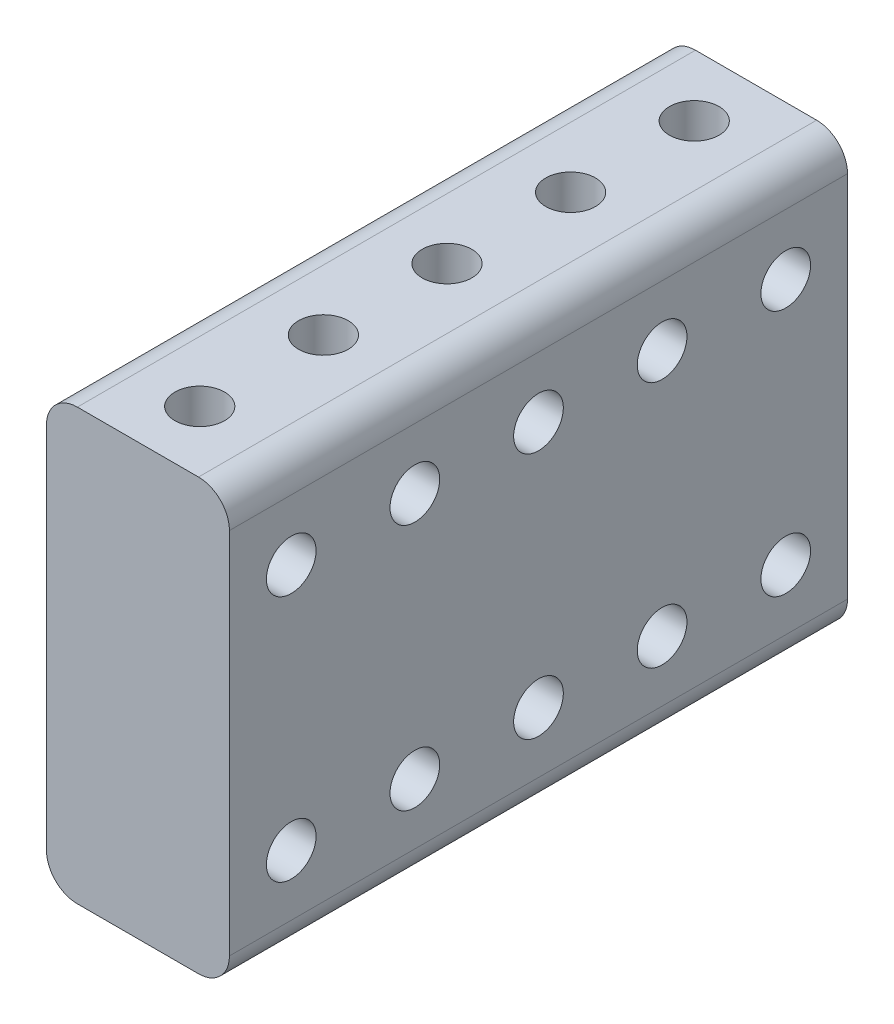
from build123d import *

# Parameters (mm, degrees)
SKETCH1_W           = 18.796
SKETCH1_H           = 44.196
BOSS_EXTRUDE1_DEPTH = 63.5
FILLET1_R           = 3.175
SKETCH2_R           = 2.5527
CUT_EXTRUDE1_DEPTH  = 63.5
SKETCH3_R           = 2.5527
CUT_EXTRUDE2_DEPTH  = 63.5


with BuildPart() as part:
    # Sketch1 → Boss-Extrude1 (new body)
    with BuildSketch(Plane.XY):
        with Locations((9.398, 22.098)):
            Rectangle(SKETCH1_W, SKETCH1_H)
    extrude(amount=BOSS_EXTRUDE1_DEPTH)

    # Fillet1
    fillet1_edges = [part.edges().sort_by_distance(p)[0] for p in [
        (0, 44.196, 31.75),
        (18.796, 0, 31.75),
        (0, 0, 31.75),
        (18.796, 44.196, 31.75),
    ]]
    fillet(fillet1_edges, radius=FILLET1_R)

    # Sketch2 → Cut-Extrude1 (cut)
    with BuildSketch(Plane(origin=(0, 44.196, 0), x_dir=(1, 0, 0), z_dir=(0, 1, 0))):
        with Locations((9.398, -6.35)):
            Circle(SKETCH2_R)
        with Locations((9.398, -19.05)):
            Circle(SKETCH2_R)
        with Locations((9.398, -31.75)):
            Circle(SKETCH2_R)
        with Locations((9.398, -44.45)):
            Circle(SKETCH2_R)
        with Locations((9.398, -57.15)):
            Circle(SKETCH2_R)
    extrude(amount=-CUT_EXTRUDE1_DEPTH, mode=Mode.SUBTRACT)

    # Sketch3 → Cut-Extrude2 (cut)
    with BuildSketch(Plane(origin=(18.796, 0, 0), x_dir=(0, 0, -1), z_dir=(1, 0, 0))):
        with Locations((-57.15, 34.798)):
            Circle(SKETCH3_R)
        with Locations((-44.45, 34.798)):
            Circle(SKETCH3_R)
        with Locations((-31.75, 34.798)):
            Circle(SKETCH3_R)
        with Locations((-19.05, 34.798)):
            Circle(SKETCH3_R)
        with Locations((-6.35, 34.798)):
            Circle(SKETCH3_R)
        with Locations((-44.45, 9.398)):
            Circle(SKETCH3_R)
        with Locations((-31.75, 9.398)):
            Circle(SKETCH3_R)
        with Locations((-19.05, 9.398)):
            Circle(SKETCH3_R)
        with Locations((-6.35, 9.398)):
            Circle(SKETCH3_R)
        with Locations((-57.15, 9.398)):
            Circle(SKETCH3_R)
    extrude(amount=-CUT_EXTRUDE2_DEPTH, mode=Mode.SUBTRACT)


solid = part.part
